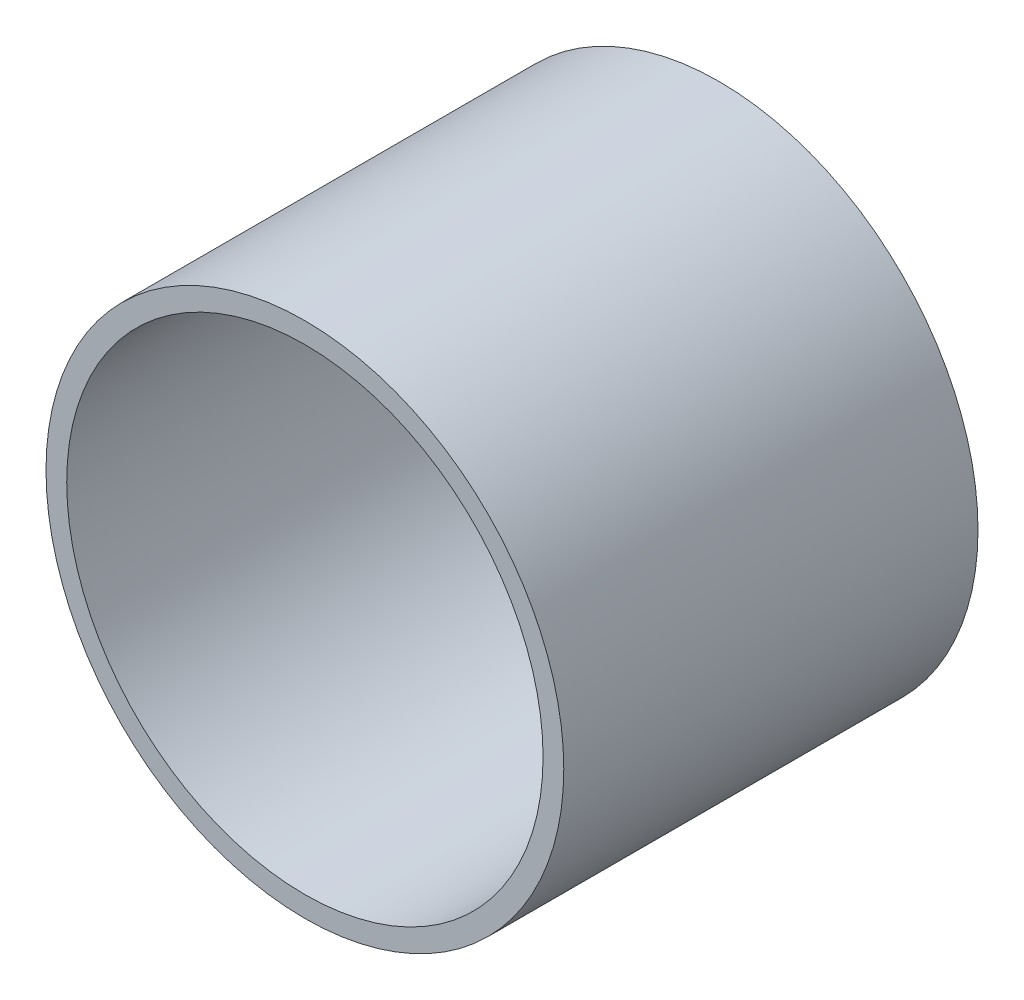
from build123d import *

# Parameters (mm, degrees)
SKETCH1_R      = 3.96875
EXTRUDE1_DEPTH = 6.35
SHELL1_T       = -0.3175


with BuildPart() as part:
    # Sketch1 → Extrude1 (new body)
    with BuildSketch(Plane.XY):
        Circle(SKETCH1_R)
    extrude(amount=EXTRUDE1_DEPTH)

    # Shell1
    shell1_openings = [part.faces().sort_by_distance(p)[0] for p in [
        (0, 0, 0),
        (0, 0, 6.35),
    ]]
    offset(amount=SHELL1_T, openings=shell1_openings, kind=Kind.INTERSECTION)


solid = part.part
